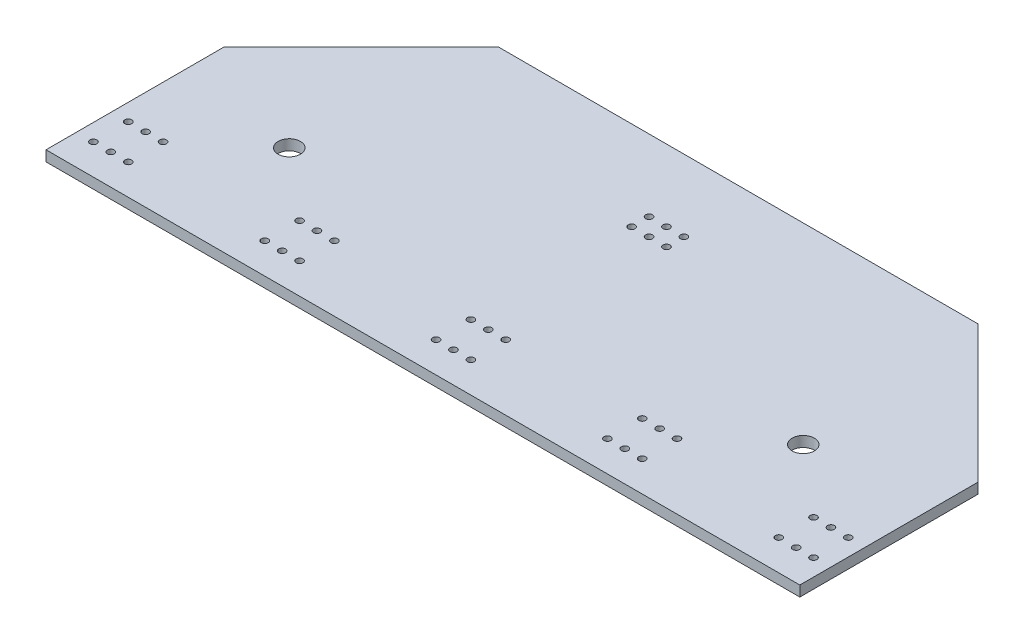
from build123d import *

# Parameters (mm, degrees)
SKETCH1_W             = 110
SKETCH1_H             = 50
BOSS_EXTRUDE1_DEPTH   = 1.53
SKETCH6_W             = 141.050966046
SKETCH6_H             = 69.53153639
CUT_EXTRUDE4_DEPTH    = 62.736058345
SKETCH2_R             = 0.5
PUSHBUTTONHOLES_DEPTH = 62.736058345
SKETCH7_R             = 1.625
MOUNT_HOLES_DEPTH     = 62.736058345
SKETCH5_R             = 0.5
RJ12HOLES_DEPTH       = 62.736058345
LPATTERN1_COUNT       = 3
LPATTERN1_PITCH       = 25
LPATTERN1_COL_COUNT   = 3
LPATTERN1_COL_PITCH   = 25


with BuildPart() as part:
    # Sketch1 → Boss-Extrude1 (new body)
    with BuildSketch(Plane(origin=(0, 0, 0), x_dir=(1, 0, 0), z_dir=(0, 1, 0))):
        with Locations((0, 3)):
            Rectangle(SKETCH1_W, SKETCH1_H)
    extrude(amount=BOSS_EXTRUDE1_DEPTH)

    # Sketch6 → Cut-Extrude4 (cut, through all)
    with BuildSketch(Plane(origin=(0, 1.53, 0), x_dir=(1, 0, 0), z_dir=(0, 1, 0))):
        Rectangle(SKETCH6_W, SKETCH6_H)
        Polygon((-55, 8), (-35, 28), (35, 28), (55, 8), (55, -18), (-55, -18), align=None, mode=Mode.SUBTRACT)
    extrude(amount=-CUT_EXTRUDE4_DEPTH, mode=Mode.SUBTRACT)

    # Sketch2 → PushButtonHoles (cut, through all)
    with BuildSketch(Plane(origin=(0, 1.53, 0), x_dir=(1, 0, 0), z_dir=(0, 1, 0))):
        with Locations((-2.54, -8.46)):
            Circle(SKETCH2_R)
        with Locations((0, -8.46)):
            Circle(SKETCH2_R)
        with Locations((2.54, -8.46)):
            Circle(SKETCH2_R)
        with Locations((-2.54, -13.54)):
            Circle(SKETCH2_R)
        with Locations((0, -13.54)):
            Circle(SKETCH2_R)
        with Locations((2.54, -13.54)):
            Circle(SKETCH2_R)
    pushbuttonholes = extrude(amount=-PUSHBUTTONHOLES_DEPTH, mode=Mode.SUBTRACT)

    # Sketch7 → Mount Holes (cut, through all)
    with BuildSketch(Plane(origin=(0, 1.53, 0), x_dir=(1, 0, 0), z_dir=(0, 1, 0))):
        with Locations((-37.5, 0)):
            Circle(SKETCH7_R)
        with Locations((37.5, 0)):
            Circle(SKETCH7_R)
    extrude(amount=-MOUNT_HOLES_DEPTH, mode=Mode.SUBTRACT)

    # Sketch5 → RJ12Holes (cut, through all)
    with BuildSketch(Plane(origin=(0, 1.53, 0), x_dir=(1, 0, 0), z_dir=(0, 1, 0))):
        with Locations((-2.54, 17.54)):
            Circle(SKETCH5_R)
        with Locations((0, 17.54)):
            Circle(SKETCH5_R)
        with Locations((2.54, 17.54)):
            Circle(SKETCH5_R)
        with Locations((-2.54, 15)):
            Circle(SKETCH5_R)
        with Locations((0, 15)):
            Circle(SKETCH5_R)
        with Locations((2.54, 15)):
            Circle(SKETCH5_R)
    extrude(amount=-RJ12HOLES_DEPTH, mode=Mode.SUBTRACT)

    # LPattern1: PushButtonHoles ×3
    with Locations(*[(i * LPATTERN1_PITCH, 0, 0) for i in range(1, LPATTERN1_COUNT)]):
        add(pushbuttonholes, mode=Mode.SUBTRACT)

    # LPattern1 col: PushButtonHoles ×3
    with Locations(*[(-i * LPATTERN1_COL_PITCH, 0, 0) for i in range(1, LPATTERN1_COL_COUNT)]):
        add(pushbuttonholes, mode=Mode.SUBTRACT)


solid = part.part
